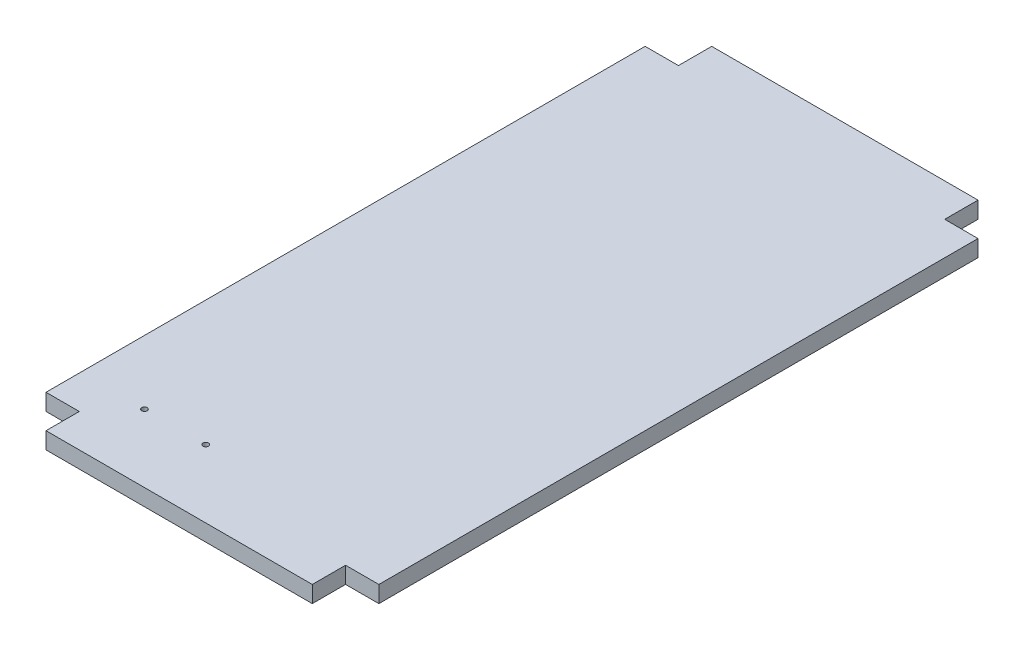
from build123d import *

# Parameters (mm, degrees)
SKETCH1_R           = 3.175
BOSS_EXTRUDE1_DEPTH = 19.05


with BuildPart() as part:
    # Sketch1 → Boss-Extrude1 (new body)
    with BuildSketch(Plane(origin=(0, 0, 0), x_dir=(1, 0, 0), z_dir=(0, 1, 0))):
        Polygon((-194.750523985, -920.183896908), (-194.750523985, -234.383896908), (-156.650523985, -234.383896908), (-156.650523985, -196.283896908), (148.149476015, -196.283896908), (148.149476015, -234.383896908), (186.249476015, -234.383896908), (186.249476015, -920.183896908), (148.149476015, -920.183896908), (148.149476015, -958.283896908), (-156.650523985, -958.283896908), (-156.650523985, -920.183896908), align=None)
        with Locations((-121.63751538, -880.653896908)):
            Circle(SKETCH1_R, mode=Mode.SUBTRACT)
        with Locations((-51.43751538, -880.653896908)):
            Circle(SKETCH1_R, mode=Mode.SUBTRACT)
    extrude(amount=BOSS_EXTRUDE1_DEPTH)


solid = part.part
